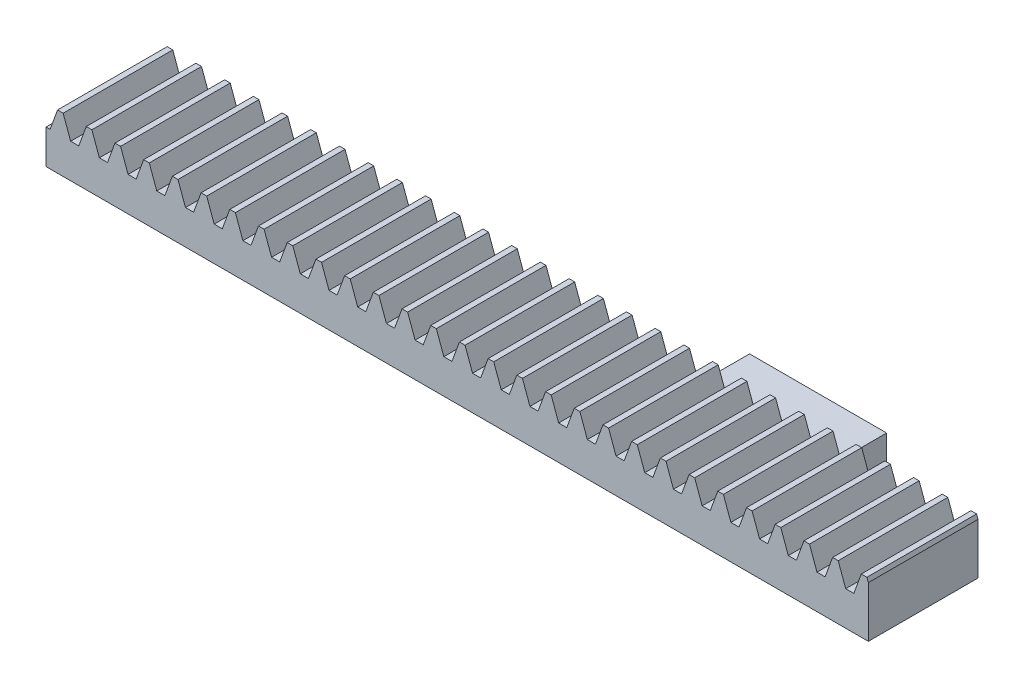
from build123d import *

# Parameters (mm, degrees)
BLANKSKE_W          = 90
BLANKSKE_H          = 6
BLANK_DEPTH         = 12
TOOTHCUTSIM_DEPTH   = 91.994505329
TEETHCUTS_COUNT     = 30
TEETHCUTS_PITCH     = 3.14159265
SKETCH1_W           = 15
SKETCH1_H           = 3.75
BOSS_EXTRUDE1_DEPTH = 5


with BuildPart() as part:
    # BlankSke → Blank (new body)
    with BuildSketch(Plane.XY):
        with Locations((45, 3)):
            Rectangle(BLANKSKE_W, BLANKSKE_H)
    extrude(amount=-BLANK_DEPTH)

    # TooCutSkeSim → ToothCutSim (cut, through all)
    with BuildSketch(Plane.XY):
        Polygon((0.44443537, 3.75), (-0.44443537, 3.75), (-1.272613241, 6.0254), (1.272613241, 6.0254), align=None)
    toothcutsim = extrude(amount=-TOOTHCUTSIM_DEPTH, mode=Mode.SUBTRACT)

    # TeethCuts: ToothCutSim ×30
    with Locations(*[(i * TEETHCUTS_PITCH, 0, 0) for i in range(1, TEETHCUTS_COUNT)]):
        add(toothcutsim, mode=Mode.SUBTRACT)

    # Sketch1 → Boss-Extrude1 (add)
    with BuildSketch(Plane(origin=(0, 0, -12), x_dir=(-1, 0, 0), z_dir=(0, 0, -1))):
        with Locations((-67.5, 1.875)):
            Rectangle(SKETCH1_W, SKETCH1_H)
    extrude(amount=BOSS_EXTRUDE1_DEPTH)


solid = part.part
